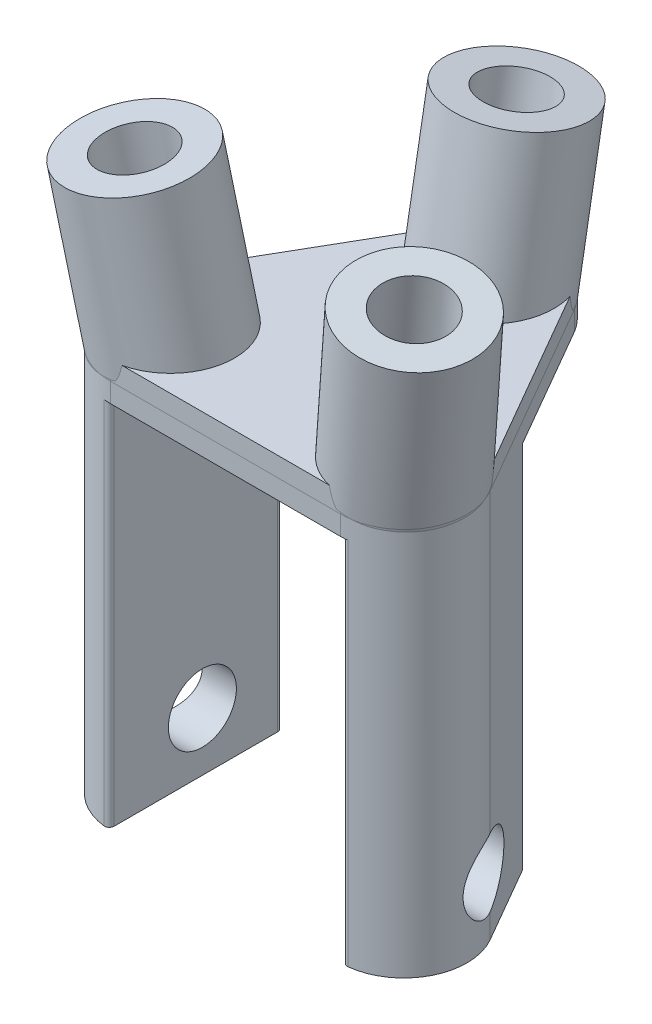
from build123d import *

# Parameters (mm, degrees)
BOSS_EXTRUDE1_DEPTH     = 1
BOSS_EXTRUDE2_START     = -0.013518
SKETCH2_R               = 3.25
SKETCH2_R_2             = 1.75
BOSS_EXTRUDE2_DEPTH     = 8.25
CIRPATTERN4_COUNT       = 3
BOSS_EXTRUDE3_DEPTH     = 20
CUT_EXTRUDE1_DEPTH      = 27.666666667
CUT_EXTRUDE1_DEPTH_BACK = 27.666666667
SKETCH5_W               = 12
SKETCH5_H               = 19
CUT_EXTRUDE2_DEPTH      = 27.666666667
CUT_EXTRUDE2_DEPTH_BACK = 27.666666667
SKETCH6_R               = 1.75
FILLET1_R               = 3.25
FILLET2_R               = 0.25


with BuildPart() as part:
    # Sketch1 → Boss-Extrude1 (new body)
    with BuildSketch(Plane(origin=(0, 0, 0), x_dir=(1, 0, 0), z_dir=(0, 1, 0))):
        Polygon((0, 13.333333333), (-11.547005384, -6.666666667), (11.547005384, -6.666666667), align=None)
    extrude(amount=BOSS_EXTRUDE1_DEPTH)

    # Sketch2 → Boss-Extrude2 (add)
    with BuildSketch(Plane(origin=(0, 1.539879883, -0.27152237), x_dir=(1, 0, 0), z_dir=(0, 0.984807753012208, -0.17364817766693072)).offset(BOSS_EXTRUDE2_START)):
        with Locations(Location((0, 6.704689978, 0), (0, 0, 270))):
            Circle(SKETCH2_R)
        with Locations(Location((0, 6.704689978, 0), (0, 0, 270))):
            Circle(SKETCH2_R_2, mode=Mode.SUBTRACT)
    extrude(amount=BOSS_EXTRUDE2_DEPTH)


with BuildPart() as cirpattern4_1:
    # CirPattern4: pattern copy
    add(part.part.rotate(Axis((0, 0, 0), (0, 1, 0)), 1 * 360 / CIRPATTERN4_COUNT))


with BuildPart() as cirpattern4_2:
    # CirPattern4: pattern copy
    add(part.part.rotate(Axis((0, 0, 0), (0, 1, 0)), 2 * 360 / CIRPATTERN4_COUNT))


with BuildPart() as part_1:
    add(part.part)

    add(cirpattern4_1.part)  # Boss-Extrude3 merges CirPattern4_1

    add(cirpattern4_2.part)  # Boss-Extrude3 merges CirPattern4_2
    # Sketch3 → Boss-Extrude3 (add)
    with BuildSketch(Plane(origin=(0, 0, 0), x_dir=(1, 0, 0), z_dir=(0, 1, 0))):
        Polygon((0, 13.333333333), (-11.547005384, -6.666666667), (11.547005384, -6.666666667), align=None)
    extrude(amount=-BOSS_EXTRUDE3_DEPTH)

    # Sketch5 → Cut-Extrude1 (cut, two sides: drawn at the far end of the back side and taken through both)
    with BuildSketch(Plane.XY.offset(-CUT_EXTRUDE1_DEPTH_BACK)):
        with Locations((0, -10.5)):
            Rectangle(SKETCH5_W, SKETCH5_H)
    extrude(amount=CUT_EXTRUDE1_DEPTH + CUT_EXTRUDE1_DEPTH_BACK, mode=Mode.SUBTRACT)

    # Sketch6 → Cut-Extrude2 (cut, two sides: drawn at the far end of the back side and taken through both)
    with BuildSketch(Plane(origin=(0, 0, 0), x_dir=(0, 0, -1), z_dir=(1, 0, 0)).offset(-CUT_EXTRUDE2_DEPTH_BACK)):
        with Locations(Location((-1.862819089, -17, 0), (0, 0, 270))):
            Circle(SKETCH6_R)
    extrude(amount=CUT_EXTRUDE2_DEPTH + CUT_EXTRUDE2_DEPTH_BACK, mode=Mode.SUBTRACT)

    # Fillet1
    # the kernel refuses this fillet: 3.25 mm, written as the material it takes off along each edge
    with BuildSketch(Plane(origin=(-11.547005384, -34.072912811, 6.666666667), x_dir=(0.5000000000000006, 0, -0.8660254037844383), z_dir=(0, 1, 0))) as fillet1_piece_1_section:
        with BuildLine():
            CenterArc((FILLET1_R * 1.73205080757, -FILLET1_R), FILLET1_R, 90, 120)
            Line((FILLET1_R * 0.866025403784, -FILLET1_R * 1.5), (0, 0))
            Line((0, 0), (FILLET1_R * 1.73205080757, 0))
        make_face()
    fillet1_piece_1 = extrude(amount=49.145825623, mode=Mode.PRIVATE)
    fillet1_piece_1 = split(fillet1_piece_1, bisect_by=Plane(origin=(-10.97448612, -0.66169158, 6.350447494), z_dir=(0.15038373318043566, -0.9848077530122081, -0.08682408883346533)), keep=Keep.TOP, mode=Mode.PRIVATE)
    add(fillet1_piece_1, mode=Mode.SUBTRACT)
    with BuildSketch(Plane(origin=(-11.547005384, -34.072912811, 6.666666667), x_dir=(0.5000000000000006, 0, -0.8660254037844383), z_dir=(0, 1, 0))) as fillet1_piece_2_section:
        with BuildLine():
            CenterArc((FILLET1_R * 1.73205080757, -FILLET1_R), FILLET1_R, 90, 120)
            Line((FILLET1_R * 0.866025403784, -FILLET1_R * 1.5), (0, 0))
            Line((0, 0), (FILLET1_R * 1.73205080757, 0))
        make_face()
    fillet1_piece_2 = extrude(amount=49.145825623, mode=Mode.PRIVATE)
    fillet1_piece_2 = fillet1_piece_2 - Plane(origin=(-6.05222024, 1.022993423, 3.494250985), x_dir=(0.8528685319524435, 0.17364817766693075, -0.4924038765061036), z_dir=(0.15038373318043563, -0.984807753012208, -0.0868240888334653)) * Cylinder(3.25, 121, mode=Mode.PRIVATE)
    add(fillet1_piece_2, mode=Mode.SUBTRACT)
    with BuildSketch(Plane(origin=(11.547005384, 15.072912811, 6.666666667), x_dir=(-0.4999999999999995, 3.2869908736946534e-15, -0.866025403784439), z_dir=(0, -1, 0))) as fillet1_piece_3_section:
        with BuildLine():
            CenterArc((FILLET1_R * 1.73205080757, -FILLET1_R), FILLET1_R, 90, 120)
            Line((FILLET1_R * 0.866025403784, -FILLET1_R * 1.5), (0, 0))
            Line((0, 0), (FILLET1_R * 1.73205080757, 0))
        make_face()
    fillet1_piece_3 = extrude(amount=49.145825623, mode=Mode.PRIVATE)
    fillet1_piece_3 = split(fillet1_piece_3, bisect_by=Plane(origin=(6.196775139, 0.040615558, 6.659722255), z_dir=(-0.15038373318043557, -0.9848077530122081, -0.08682408883346546)), keep=Keep.TOP, mode=Mode.PRIVATE)
    add(fillet1_piece_3, mode=Mode.SUBTRACT)
    with BuildSketch(Plane(origin=(11.547005384, 15.072912811, 6.666666667), x_dir=(-0.4999999999999995, 3.2869908736946534e-15, -0.866025403784439), z_dir=(0, -1, 0))) as fillet1_piece_4_section:
        with BuildLine():
            CenterArc((FILLET1_R * 1.73205080757, -FILLET1_R), FILLET1_R, 90, 120)
            Line((FILLET1_R * 0.866025403784, -FILLET1_R * 1.5), (0, 0))
            Line((0, 0), (FILLET1_R * 1.73205080757, 0))
        make_face()
    fillet1_piece_4 = extrude(amount=49.145825623, mode=Mode.PRIVATE)
    fillet1_piece_4 = fillet1_piece_4 - Plane(origin=(6.05222024, 1.022993422, 3.494250985), x_dir=(-0.8528685319524428, 0.17364817766693072, -0.4924038765061047), z_dir=(-0.15038373318043557, -0.984807753012208, -0.08682408883346546)) * Cylinder(3.25, 121, mode=Mode.PRIVATE)
    add(fillet1_piece_4, mode=Mode.SUBTRACT)
    with BuildSketch(Plane(origin=(0, -15.072912811, -13.333333333), x_dir=(0.49999999999999967, -2.8617107450297637e-15, 0.8660254037844389), z_dir=(0, 1, 0))) as fillet1_piece_5_section:
        with BuildLine():
            CenterArc((FILLET1_R * 1.73205080757, -FILLET1_R), FILLET1_R, 90, 120)
            Line((FILLET1_R * 0.866025403784, -FILLET1_R * 1.5), (0, 0))
            Line((0, 0), (FILLET1_R * 1.73205080757, 0))
        make_face()
    fillet1_piece_5 = extrude(amount=30.145825623, mode=Mode.PRIVATE)
    fillet1_piece_5 = split(fillet1_piece_5, bisect_by=Plane(origin=(-4e-09, -0.328352859, -10.788949692), z_dir=(0, -0.984807753012208, 0.17364817766693072)), keep=Keep.TOP, mode=Mode.PRIVATE)
    add(fillet1_piece_5, mode=Mode.SUBTRACT)
    with BuildSketch(Plane(origin=(0, -15.072912811, -13.333333333), x_dir=(0.49999999999999967, -2.8617107450297637e-15, 0.8660254037844389), z_dir=(0, 1, 0))) as fillet1_piece_6_section:
        with BuildLine():
            CenterArc((FILLET1_R * 1.73205080757, -FILLET1_R), FILLET1_R, 90, 120)
            Line((FILLET1_R * 0.866025403784, -FILLET1_R * 1.5), (0, 0))
            Line((0, 0), (FILLET1_R * 1.73205080757, 0))
        make_face()
    fillet1_piece_6 = extrude(amount=30.145825623, mode=Mode.PRIVATE)
    fillet1_piece_6 = fillet1_piece_6 - Plane(origin=(0, 1.022993423, -6.98850197), x_dir=(0, 0.17364817766693072, 0.984807753012208), z_dir=(0, -0.984807753012208, 0.17364817766693072)) * Cylinder(3.25, 83, mode=Mode.PRIVATE)
    add(fillet1_piece_6, mode=Mode.SUBTRACT)

    # Fillet2
    fillet2_edges = [part_1.edges().sort_by_distance(p)[0] for p in [
        (-6, -10.5, -2.941028488),
        (6, -10.5, -2.941028488),
        (-6, -10.5, 6.665628005),
        (6, -10.5, 6.665628005),
    ]]
    fillet(fillet2_edges, radius=FILLET2_R)


with BuildPart() as body_2:
    # Split1: the piece on the far side of the plane
    add(part_1.part)
    split(bisect_by=Plane.ZX, keep=Keep.BOTTOM)


with BuildPart() as part_2:
    add(part_1.part)

    # Split1
    split(bisect_by=Plane.ZX, keep=Keep.TOP)


solid = Compound([body_2.part, part_2.part])
